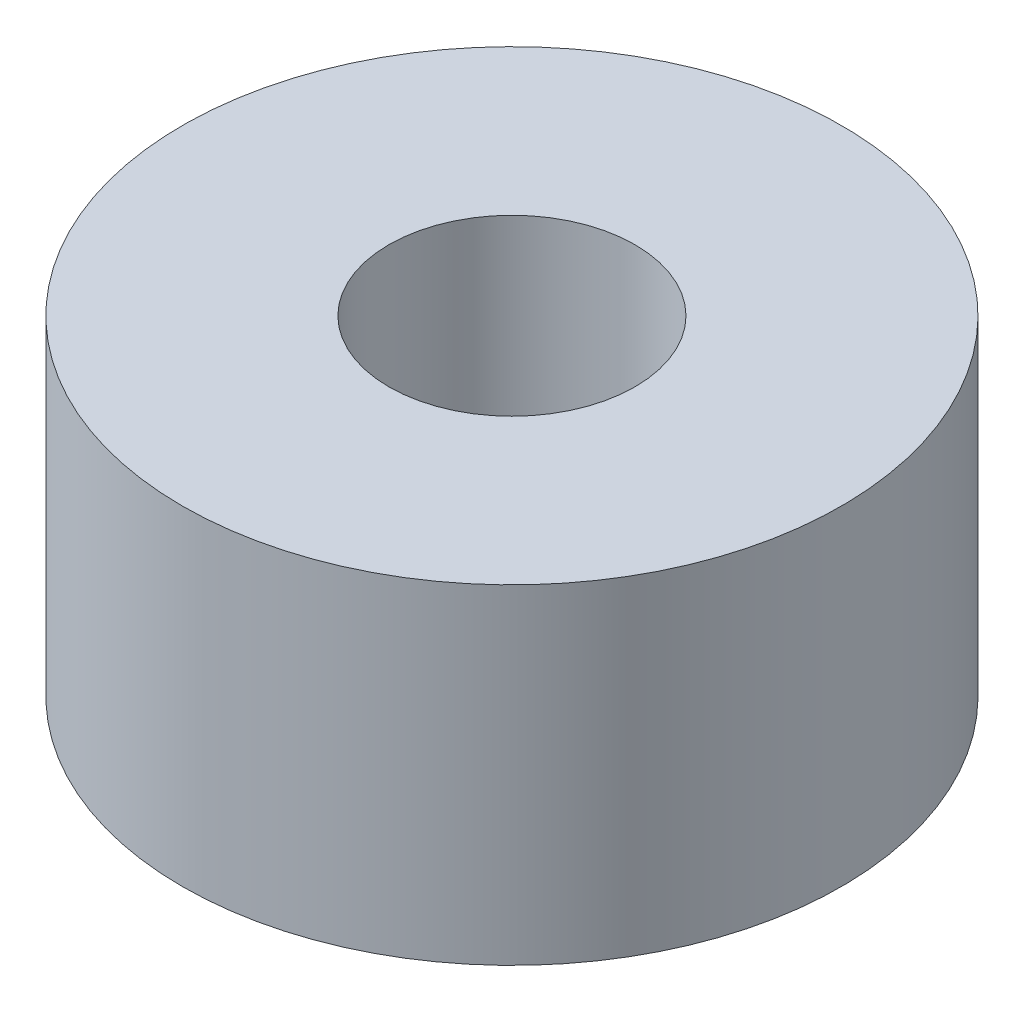
from build123d import *

# Parameters (mm, degrees)
SKETCH_2_R      = 8.5
SKETCH_2_R_2    = 3.175
EXTRUDE_1_DEPTH = 8.5


with BuildPart() as part:
    # Эскиз2 → Вытянуть1 (new body)
    with BuildSketch(Plane(origin=(0, 0, 0), x_dir=(1, 0, 0), z_dir=(0, 1, 0))):
        Circle(SKETCH_2_R)
        Circle(SKETCH_2_R_2, mode=Mode.SUBTRACT)
    extrude(amount=EXTRUDE_1_DEPTH)


solid = part.part
